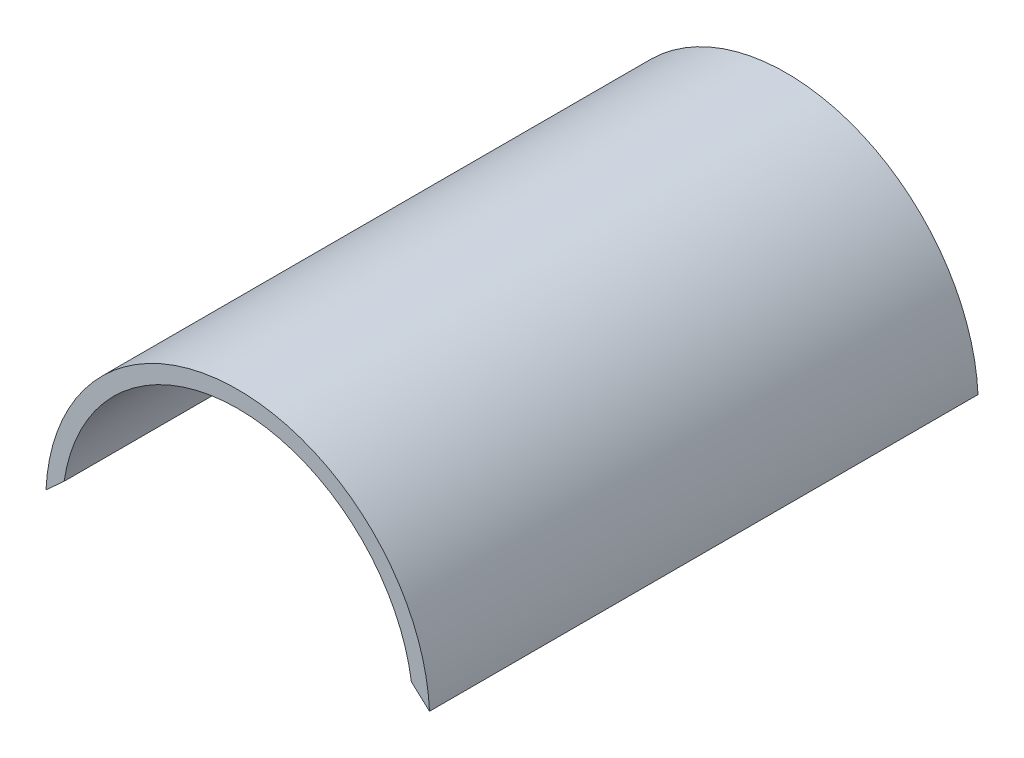
from build123d import *

# Parameters (mm, degrees)
BOSS_EXTRUDE1_DEPTH = 127


with BuildPart() as part:
    # Sketch1 → Boss-Extrude1 (new body)
    with BuildSketch(Plane.XY):
        with BuildLine():
            Line((-40.203883769, 5.937788296), (-44.399042974, 2.127788296))
            ThreePointArc((-44.399042974, 2.127788296), (0, 44.45), (44.399042974, 2.127788296))
            Line((44.399042974, 2.127788296), (40.203883769, 5.937788296))
            ThreePointArc((40.203883769, 5.937788296), (0, 40.64), (-40.203883769, 5.937788296))
        make_face()
    extrude(amount=BOSS_EXTRUDE1_DEPTH)


solid = part.part
